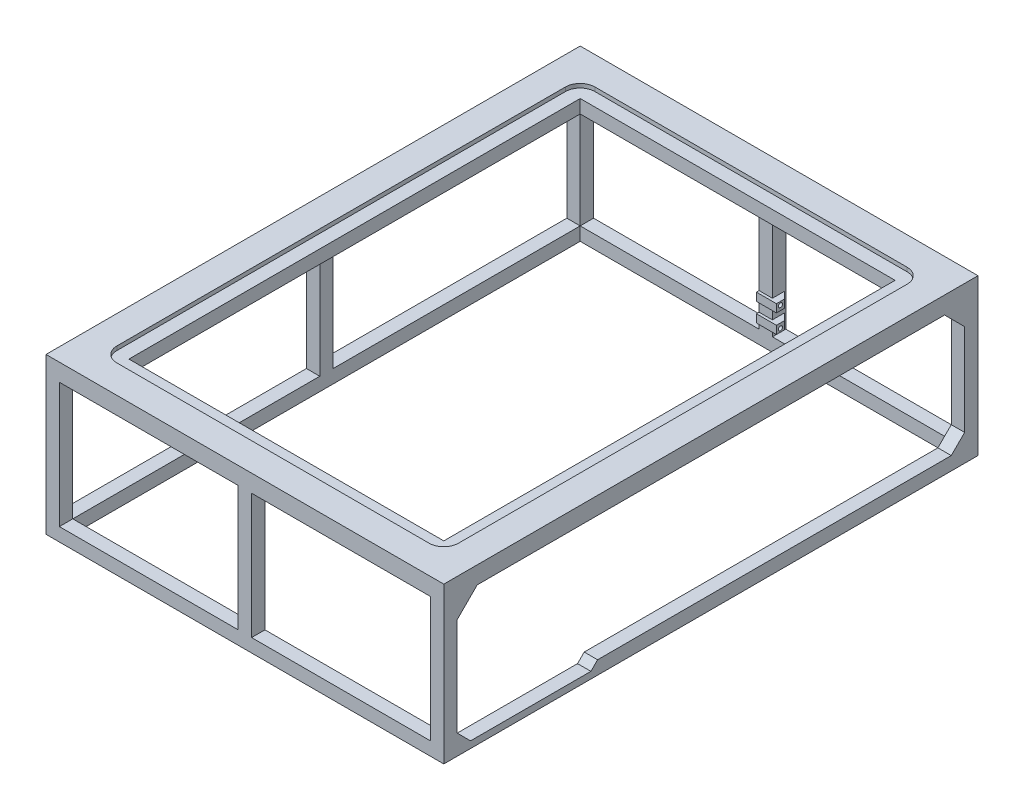
from build123d import *

# Parameters (mm, degrees)
SKETCH1_W           = 297.5
SKETCH1_H           = 399.5
SKETCH1_W_2         = 277.5
SKETCH1_H_2         = 379.5
BOSS_EXTRUDE1_DEPTH = 10
SKETCH2_W           = 10
SKETCH2_H           = 10
BOSS_EXTRUDE2_DEPTH = 93.5
SKETCH3_W           = 297.5
SKETCH3_H           = 399.5
SKETCH3_W_2         = 235.5
SKETCH3_H_2         = 337.5
BOSS_EXTRUDE3_DEPTH = 10
CUT_EXTRUDE1_DEPTH  = 1.2
SKETCH6_W           = 297.5
SKETCH6_H           = 399.5
BOSS_EXTRUDE4_DEPTH = 3
SKETCH7_W           = 14
SKETCH7_H           = 93.5
CUT_EXTRUDE2_DEPTH  = 16.15
CHAMFER1_SIZE       = 15
SKETCH8_W           = 4
SKETCH8_H           = 6
SKETCH8_W_2         = 2
BOSS_EXTRUDE5_DEPTH = 5
SKETCH10_W          = 2
SKETCH10_H          = 6
BOSS_EXTRUDE6_DEPTH = 10
CUT_EXTRUDE4_DEPTH  = 18
CHAMFER2_SIZE       = 5
SKETCH12_W          = 95
SKETCH12_H          = 5
CUT_EXTRUDE5_DEPTH  = 10
CHAMFER3_SIZE       = 10


# Some blends are built 0.0001 mm under size
with BuildPart() as part:
    # Sketch1 → Boss-Extrude1 (new body)
    with BuildSketch(Plane(origin=(0, 0, 0), x_dir=(1, 0, 0), z_dir=(0, 1, 0))):
        with Locations((126.75, 177.75)):
            Rectangle(SKETCH1_W, SKETCH1_H)
        with Locations((126.75, 177.75)):
            Rectangle(SKETCH1_W_2, SKETCH1_H_2, mode=Mode.SUBTRACT)
    extrude(amount=BOSS_EXTRUDE1_DEPTH)

    # Sketch2 → Boss-Extrude2 (add)
    with BuildSketch(Plane(origin=(0, 10, 0), x_dir=(1, 0, 0), z_dir=(0, 1, 0))):
        with Locations((126.75, -17)):
            Rectangle(SKETCH2_W, SKETCH2_H)
        with Locations((270.5, -17)):
            Rectangle(SKETCH2_W, SKETCH2_H)
        with Locations((-17, -17)):
            Rectangle(SKETCH2_W, SKETCH2_H)
        with Locations((-17, 372.5)):
            Rectangle(SKETCH2_W, SKETCH2_H)
        with Locations((270.5, 372.5)):
            Rectangle(SKETCH2_W, SKETCH2_H)
        with Locations((126.75, 372.5)):
            Rectangle(SKETCH2_W, SKETCH2_H)
        with Locations((270.5, 177.75)):
            Rectangle(SKETCH2_W, SKETCH2_H)
        with Locations((-17, 177.75)):
            Rectangle(SKETCH2_W, SKETCH2_H)
    extrude(amount=BOSS_EXTRUDE2_DEPTH)

    # Sketch3 → Boss-Extrude3 (add)
    with BuildSketch(Plane(origin=(0, 103.5, 0), x_dir=(1, 0, 0), z_dir=(0, 1, 0))):
        with Locations((126.75, 177.75)):
            Rectangle(SKETCH3_W, SKETCH3_H)
        with Locations((126.75, 177.75)):
            Rectangle(SKETCH3_W_2, SKETCH3_H_2, mode=Mode.SUBTRACT)
    extrude(amount=BOSS_EXTRUDE3_DEPTH)

    # Sketch4 → Cut-Extrude1 (cut)
    with BuildSketch(Plane.XZ):
        with BuildLine():
            ThreePointArc((268.9, 17), (269.021792748, 16.387706508), (269.36862915, 15.86862915))
            Line((269.36862915, 15.86862915), (270.5, 17))
            Line((270.5, 17), (268.9, 17))
        make_face()
        with BuildLine():
            Line((270.5, 17), (269.36862915, 15.86862915))
            ThreePointArc((269.36862915, 15.86862915), (271.112293492, 15.521792748), (272.1, 17))
            Line((272.1, 17), (270.5, 17))
        make_face()
        with BuildLine():
            Line((270.5, 17), (272.1, 17))
            ThreePointArc((272.1, 17), (271.978207252, 17.612293492), (271.63137085, 18.13137085))
            Line((271.63137085, 18.13137085), (270.5, 17))
        make_face()
        with BuildLine():
            ThreePointArc((271.63137085, 18.13137085), (269.887706508, 18.478207252), (268.9, 17))
            Line((268.9, 17), (270.5, 17))
            Line((270.5, 17), (271.63137085, 18.13137085))
        make_face()
        with BuildLine():
            ThreePointArc((268.9, -177.75), (270.5, -179.35), (272.1, -177.75))
            Line((272.1, -177.75), (268.9, -177.75))
        make_face()
        with BuildLine():
            Line((268.9, -177.75), (272.1, -177.75))
            ThreePointArc((272.1, -177.75), (270.5, -176.15), (268.9, -177.75))
        make_face()
        with BuildLine():
            ThreePointArc((272.1, -372.5), (271.112293492, -371.021792748), (269.36862915, -371.36862915))
            Line((269.36862915, -371.36862915), (270.5, -372.5))
            Line((270.5, -372.5), (272.1, -372.5))
        make_face()
        with BuildLine():
            Line((270.5, -372.5), (269.36862915, -371.36862915))
            ThreePointArc((269.36862915, -371.36862915), (269.021792748, -371.887706508), (268.9, -372.5))
            Line((268.9, -372.5), (270.5, -372.5))
        make_face()
        with BuildLine():
            ThreePointArc((271.63137085, -373.63137085), (271.978207252, -373.112293492), (272.1, -372.5))
            Line((272.1, -372.5), (270.5, -372.5))
            Line((270.5, -372.5), (271.63137085, -373.63137085))
        make_face()
        with BuildLine():
            Line((270.5, -372.5), (268.9, -372.5))
            ThreePointArc((268.9, -372.5), (269.887706508, -373.978207252), (271.63137085, -373.63137085))
            Line((271.63137085, -373.63137085), (270.5, -372.5))
        make_face()
        with BuildLine():
            ThreePointArc((125.15, 17), (125.61862915, 15.86862915), (126.75, 15.4))
            Line((126.75, 15.4), (126.75, 17))
            Line((126.75, 17), (125.15, 17))
        make_face()
        with BuildLine():
            Line((126.75, 17), (126.75, 15.4))
            ThreePointArc((126.75, 15.4), (127.88137085, 15.86862915), (128.35, 17))
            Line((128.35, 17), (126.75, 17))
        make_face()
        with BuildLine():
            Line((126.75, 17), (128.35, 17))
            ThreePointArc((128.35, 17), (127.88137085, 18.13137085), (126.75, 18.6))
            Line((126.75, 18.6), (126.75, 17))
        make_face()
        with BuildLine():
            Line((125.15, 17), (126.75, 17))
            Line((126.75, 17), (126.75, 18.6))
            ThreePointArc((126.75, 18.6), (125.61862915, 18.13137085), (125.15, 17))
        make_face()
        with BuildLine():
            ThreePointArc((128.35, -372.5), (127.88137085, -371.36862915), (126.75, -370.9))
            Line((126.75, -370.9), (126.75, -372.5))
            Line((126.75, -372.5), (128.35, -372.5))
        make_face()
        with BuildLine():
            Line((126.75, -372.5), (126.75, -370.9))
            ThreePointArc((126.75, -370.9), (125.61862915, -371.36862915), (125.15, -372.5))
            Line((125.15, -372.5), (126.75, -372.5))
        make_face()
        with BuildLine():
            ThreePointArc((126.75, -374.1), (127.88137085, -373.63137085), (128.35, -372.5))
            Line((128.35, -372.5), (126.75, -372.5))
            Line((126.75, -372.5), (126.75, -374.1))
        make_face()
        with BuildLine():
            Line((126.75, -374.1), (126.75, -372.5))
            Line((126.75, -372.5), (125.15, -372.5))
            ThreePointArc((125.15, -372.5), (125.61862915, -373.63137085), (126.75, -374.1))
        make_face()
        with BuildLine():
            ThreePointArc((-18.6, 17), (-18.13137085, 15.86862915), (-17, 15.4))
            Line((-17, 15.4), (-17, 17))
            Line((-17, 17), (-18.6, 17))
        make_face()
        with BuildLine():
            Line((-17, 17), (-15.4, 17))
            ThreePointArc((-15.4, 17), (-15.86862915, 18.13137085), (-17, 18.6))
            Line((-17, 18.6), (-17, 17))
        make_face()
        with BuildLine():
            ThreePointArc((-17, 15.4), (-16.387706508, 15.521792748), (-15.86862915, 15.86862915))
            Line((-15.86862915, 15.86862915), (-17, 17))
            Line((-17, 17), (-17, 15.4))
        make_face()
        with BuildLine():
            Line((-18.13137085, 18.13137085), (-17, 17))
            Line((-17, 17), (-17, 18.6))
            ThreePointArc((-17, 18.6), (-17.612293492, 18.478207252), (-18.13137085, 18.13137085))
        make_face()
        with BuildLine():
            Line((-17, 17), (-15.86862915, 15.86862915))
            ThreePointArc((-15.86862915, 15.86862915), (-15.521792748, 16.387706508), (-15.4, 17))
            Line((-15.4, 17), (-17, 17))
        make_face()
        with BuildLine():
            Line((-18.6, 17), (-17, 17))
            Line((-17, 17), (-18.13137085, 18.13137085))
            ThreePointArc((-18.13137085, 18.13137085), (-18.478207252, 17.612293492), (-18.6, 17))
        make_face()
        with BuildLine():
            ThreePointArc((-17, -179.35), (-15.86862915, -178.88137085), (-15.4, -177.75))
            Line((-15.4, -177.75), (-17, -177.75))
            Line((-17, -177.75), (-17, -179.35))
        make_face()
        with BuildLine():
            Line((-17, -177.75), (-15.4, -177.75))
            ThreePointArc((-15.4, -177.75), (-15.86862915, -176.61862915), (-17, -176.15))
            Line((-17, -176.15), (-17, -177.75))
        make_face()
        with BuildLine():
            Line((-17, -179.35), (-17, -177.75))
            Line((-17, -177.75), (-18.6, -177.75))
            ThreePointArc((-18.6, -177.75), (-18.13137085, -178.88137085), (-17, -179.35))
        make_face()
        with BuildLine():
            Line((-18.6, -177.75), (-17, -177.75))
            Line((-17, -177.75), (-17, -176.15))
            ThreePointArc((-17, -176.15), (-18.13137085, -176.61862915), (-18.6, -177.75))
        make_face()
        with BuildLine():
            ThreePointArc((-15.4, -372.5), (-15.521792748, -371.887706508), (-15.86862915, -371.36862915))
            Line((-15.86862915, -371.36862915), (-17, -372.5))
            Line((-17, -372.5), (-15.4, -372.5))
        make_face()
        with BuildLine():
            Line((-18.13137085, -373.63137085), (-17, -372.5))
            Line((-17, -372.5), (-18.6, -372.5))
            ThreePointArc((-18.6, -372.5), (-18.478207252, -373.112293492), (-18.13137085, -373.63137085))
        make_face()
        with BuildLine():
            Line((-17, -372.5), (-15.86862915, -371.36862915))
            ThreePointArc((-15.86862915, -371.36862915), (-16.387706508, -371.021792748), (-17, -370.9))
            Line((-17, -370.9), (-17, -372.5))
        make_face()
        with BuildLine():
            Line((-17, -374.1), (-17, -372.5))
            Line((-17, -372.5), (-18.13137085, -373.63137085))
            ThreePointArc((-18.13137085, -373.63137085), (-17.612293492, -373.978207252), (-17, -374.1))
        make_face()
        with BuildLine():
            Line((-17, -372.5), (-17, -370.9))
            ThreePointArc((-17, -370.9), (-18.13137085, -371.36862915), (-18.6, -372.5))
            Line((-18.6, -372.5), (-17, -372.5))
        make_face()
        with BuildLine():
            ThreePointArc((-17, -374.1), (-15.86862915, -373.63137085), (-15.4, -372.5))
            Line((-15.4, -372.5), (-17, -372.5))
            Line((-17, -372.5), (-17, -374.1))
        make_face()
    extrude(amount=-CUT_EXTRUDE1_DEPTH, mode=Mode.SUBTRACT)

    # Sketch6 → Boss-Extrude4 (add)
    with BuildSketch(Plane(origin=(0, 113.5, 0), x_dir=(1, 0, 0), z_dir=(0, 1, 0))):
        with Locations((126.75, 177.75)):
            Rectangle(SKETCH6_W, SKETCH6_H)
        with BuildLine():
            ThreePointArc((243.5, -1), (251.278174593, 2.221825407), (254.5, 10))
            Line((254.5, 10), (254.5, 345.5))
            ThreePointArc((254.5, 345.5), (251.278174593, 353.278174593), (243.5, 356.5))
            Line((243.5, 356.5), (10, 356.5))
            ThreePointArc((10, 356.5), (2.221825407, 353.278174593), (-1, 345.5))
            Line((-1, 345.5), (-1, 10))
            ThreePointArc((-1, 10), (2.221825407, 2.221825407), (10, -1))
            Line((10, -1), (243.5, -1))
        make_face(mode=Mode.SUBTRACT)
    extrude(amount=BOSS_EXTRUDE4_DEPTH)

    # Sketch7 → Cut-Extrude2 (cut)
    with BuildSketch(Plane(origin=(275.5, 0, 0), x_dir=(0, 0, -1), z_dir=(1, 0, 0))):
        with Locations((177.75, 56.75)):
            Rectangle(SKETCH7_W, SKETCH7_H)
    extrude(amount=-CUT_EXTRUDE2_DEPTH, mode=Mode.SUBTRACT)

    # Chamfer1
    chamfer1_edges = [part.edges().sort_by_distance(p)[0] for p in [
        (270.5, 103.5, 12),
        (270.5, 103.5, -367.5),
    ]]
    chamfer(chamfer1_edges, length=CHAMFER1_SIZE)

    # Sketch8 → Boss-Extrude5 (add)
    with BuildSketch(Plane(origin=(131.75, 0, 0), x_dir=(0, 0, -1), z_dir=(1, 0, 0))):
        with Locations((369.5, 32)):
            Rectangle(SKETCH8_W, SKETCH8_H)
        with Locations((366.5, 32)):
            Rectangle(SKETCH8_W_2, SKETCH8_H)
        with Locations((369.5, 18)):
            Rectangle(SKETCH8_W, SKETCH8_H)
        with Locations((366.5, 18)):
            Rectangle(SKETCH8_W_2, SKETCH8_H)
    extrude(amount=BOSS_EXTRUDE5_DEPTH)

    # Sketch10 → Boss-Extrude6 (add)
    with BuildSketch(Plane.ZY.offset(-131.75)):
        with Locations((-366.5, 18)):
            Rectangle(SKETCH10_W, SKETCH10_H)
        with Locations((-366.5, 32)):
            Rectangle(SKETCH10_W, SKETCH10_H)
    extrude(amount=BOSS_EXTRUDE6_DEPTH)

    # Sketch11 → Cut-Extrude4 (cut)
    with BuildSketch(Plane(origin=(136.75, 0, 0), x_dir=(0, 0, -1), z_dir=(1, 0, 0))):
        with BuildLine():
            ThreePointArc((370.05, 17.5), (368.5, 19.05), (366.95, 17.5))
            ThreePointArc((366.95, 17.5), (368.5, 15.95), (370.05, 17.5))
        make_face()
        with BuildLine():
            ThreePointArc((370.05, 32.5), (368.5, 34.05), (366.95, 32.5))
            ThreePointArc((366.95, 32.5), (368.5, 30.95), (370.05, 32.5))
        make_face()
    extrude(amount=-CUT_EXTRUDE4_DEPTH, mode=Mode.SUBTRACT)

    # Chamfer2
    chamfer2_edges = [part.edges().sort_by_distance(p)[0] for p in [
        (131.75, 18, -371.5),
        (131.75, 32, -371.5),
    ]]
    chamfer(chamfer2_edges, length=CHAMFER2_SIZE - 0.0001)  # a hair under: the kernel refuses the full size

    # Sketch12 → Cut-Extrude5 (cut)
    with BuildSketch(Plane(origin=(275.5, 0, 0), x_dir=(0, 0, -1), z_dir=(1, 0, 0))):
        with Locations((35.5, 7.5)):
            Rectangle(SKETCH12_W, SKETCH12_H)
    extrude(amount=-CUT_EXTRUDE5_DEPTH, mode=Mode.SUBTRACT)

    # Chamfer3
    # the kernel refuses this chamfer: 10 mm, written as the material it adds along each edge
    with BuildSketch(Plane(origin=(265.5, 10, -367.5), x_dir=(0, -0.027495876610586282, 0.9996219169112968), z_dir=(1, 0, 0)), Plane(origin=(275.5, 5, 12), x_dir=(0, -0.02749587661058641, -0.9996219169112968), z_dir=(-1, 0, 0))) as chamfer3_piece_1:
        Polygon((CHAMFER3_SIZE * 0.999621916911, -CHAMFER3_SIZE * 0.0274958766106), (-CHAMFER3_SIZE * 0.0274958766106, -CHAMFER3_SIZE * 0.999621916911), (0, 0), align=None)
    extrude(amount=10)
    # the kernel refuses this chamfer: 10 mm, written as the material it takes off along each edge
    with BuildSketch(Plane(origin=(301.21682988, 10, -83), x_dir=(0, -0.9996219169112968, 0.027495876610586317), z_dir=(-1, 0, 0))) as chamfer3_2_piece_1_section:
        Polygon((CHAMFER3_SIZE * 0.999621916911, -CHAMFER3_SIZE * 0.0274958766106), (-CHAMFER3_SIZE * 0.0274958766106, -CHAMFER3_SIZE * 0.999621916911), (0, 0), align=None)
    chamfer3_2_piece_1 = extrude(amount=61.433659759, mode=Mode.PRIVATE)
    chamfer3_2_piece_1 = split(chamfer3_2_piece_1, bisect_by=Plane(origin=(270.5, 5, -86.934010841), z_dir=(0, 1, 0)), keep=Keep.TOP, mode=Mode.PRIVATE)
    add(chamfer3_2_piece_1, mode=Mode.SUBTRACT)


solid = part.part
